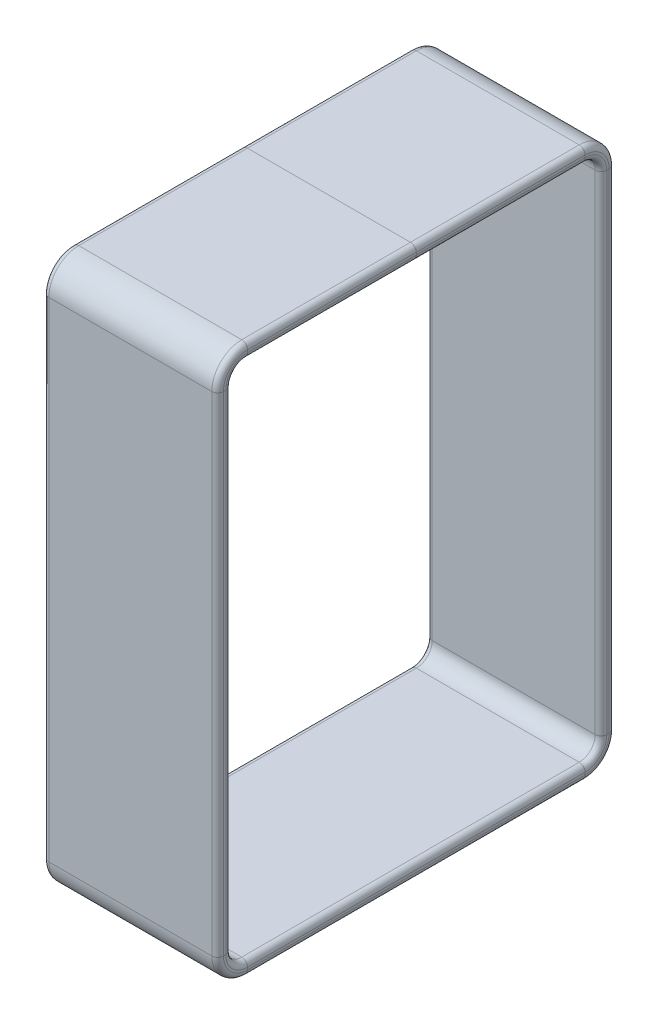
from build123d import *


with BuildPart() as part:
    # Sweep1: sweep along a path in Sketch1
    with BuildLine(Plane(origin=(0, 0, 0), x_dir=(0, 0, -1), z_dir=(1, 0, 0))) as sweep1_path:
        Line((14.5, 23), (-14.5, 23))
        ThreePointArc((-14.5, 23), (-15.914213562, 22.414213562), (-16.5, 21))
        Line((-16.5, 21), (-16.5, -21))
        ThreePointArc((-16.5, -21), (-15.914213562, -22.414213562), (-14.5, -23))
        Line((-14.5, -23), (14.5, -23))
        ThreePointArc((14.5, -23), (15.914213562, -22.414213562), (16.5, -21))
        Line((16.5, -21), (16.5, 21))
        ThreePointArc((16.5, 21), (15.914213562, 22.414213562), (14.5, 23))
    # Sketch2 → Sweep1 (sweep)
    with BuildSketch(Plane.XY):
        with BuildLine():
            Line((-7, 23.568775567), (7, 23.568775567))
            ThreePointArc((7, 23.568775567), (7.353553391, 23.422328958), (7.5, 23.068775567))
            Line((7.5, 23.068775567), (7.5, 22.868775567))
            ThreePointArc((7.5, 22.868775567), (7.353553391, 22.515222177), (7, 22.368775567))
            Line((7, 22.368775567), (-7, 22.368775567))
            ThreePointArc((-7, 22.368775567), (-7.353553391, 22.515222177), (-7.5, 22.868775567))
            Line((-7.5, 22.868775567), (-7.5, 23.068775567))
            ThreePointArc((-7.5, 23.068775567), (-7.353553391, 23.422328958), (-7, 23.568775567))
        make_face()
    sweep(path=sweep1_path.line)


solid = part.part
